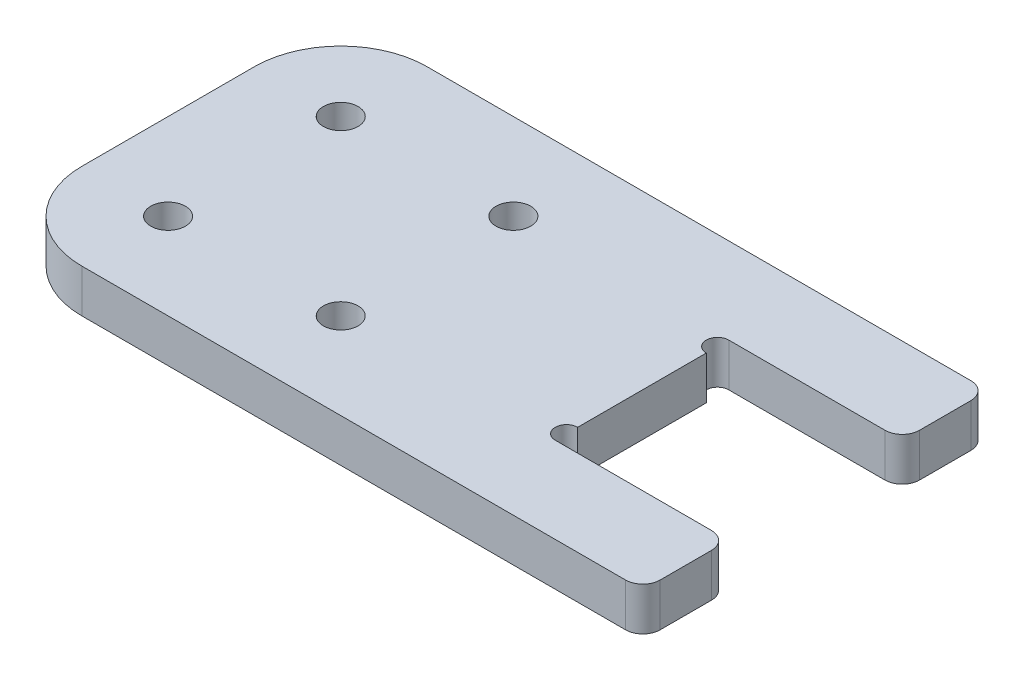
from build123d import *

# Parameters (mm, degrees)
BOSS_EXTRUDE1_DEPTH    = 6.35
F_10_CLEARANCE_HOLE1_D = 5.1054
SKETCH5_W              = 25.527
SKETCH5_H              = 25.527
CUT_EXTRUDE1_DEPTH     = 66.761600688
CUT_EXTRUDE2_DEPTH     = 66.761600688
FILLET1_R              = 2.54
FILLET2_R              = 12.7


with BuildPart() as part:
    # Sketch1 → Boss-Extrude1 (new body)
    with BuildSketch(Plane(origin=(0, 0, 0), x_dir=(1, 0, 0), z_dir=(0, 1, 0))):
        Polygon((34.925, 25.4), (60.325, 25.4), (60.325, -25.4), (34.925, -25.4), (-34.925, -25.4), (-34.925, 25.4), align=None)
    extrude(amount=BOSS_EXTRUDE1_DEPTH)

    # #10 Clearance Hole1 (through all)
    with Locations(Plane(origin=(0, 6.35, 0), x_dir=(1, 0, 0), z_dir=(0, 1, 0))):
        with Locations((-22.225, 12.7), (3.175, 12.7), (3.175, -12.7), (-22.225, -12.7)):
            Hole(F_10_CLEARANCE_HOLE1_D / 2)

    # Sketch5 → Cut-Extrude1 (cut, through all)
    with BuildSketch(Plane(origin=(0, 6.35, 0), x_dir=(1, 0, 0), z_dir=(0, 1, 0))):
        with Locations((47.5615, 0)):
            Rectangle(SKETCH5_W, SKETCH5_H)
    extrude(amount=-CUT_EXTRUDE1_DEPTH, mode=Mode.SUBTRACT)

    # Sketch6 → Cut-Extrude2 (cut, through all)
    with BuildSketch(Plane(origin=(0, 6.35, 0), x_dir=(1, 0, 0), z_dir=(0, 1, 0))):
        with BuildLine():
            Line((34.798, 9.4615), (34.798, 12.7635))
            ThreePointArc((34.798, 12.7635), (33.147, 11.1125), (34.798, 9.4615))
        make_face()
        with BuildLine():
            Line((34.798, -9.4615), (34.798, -12.7635))
            ThreePointArc((34.798, -12.7635), (33.147, -11.1125), (34.798, -9.4615))
        make_face()
    extrude(amount=-CUT_EXTRUDE2_DEPTH, mode=Mode.SUBTRACT)

    # Fillet1
    fillet1_edges = [part.edges().sort_by_distance(p)[0] for p in [
        (60.325, 3.175, 12.7635),
        (60.325, 3.175, -12.7635),
        (60.325, 3.175, -25.4),
        (60.325, 3.175, 25.4),
    ]]
    fillet(fillet1_edges, radius=FILLET1_R)

    # Fillet2
    fillet2_edges = [part.edges().sort_by_distance(p)[0] for p in [
        (-34.925, 3.175, -25.4),
        (-34.925, 3.175, 25.4),
    ]]
    fillet(fillet2_edges, radius=FILLET2_R)


solid = part.part
